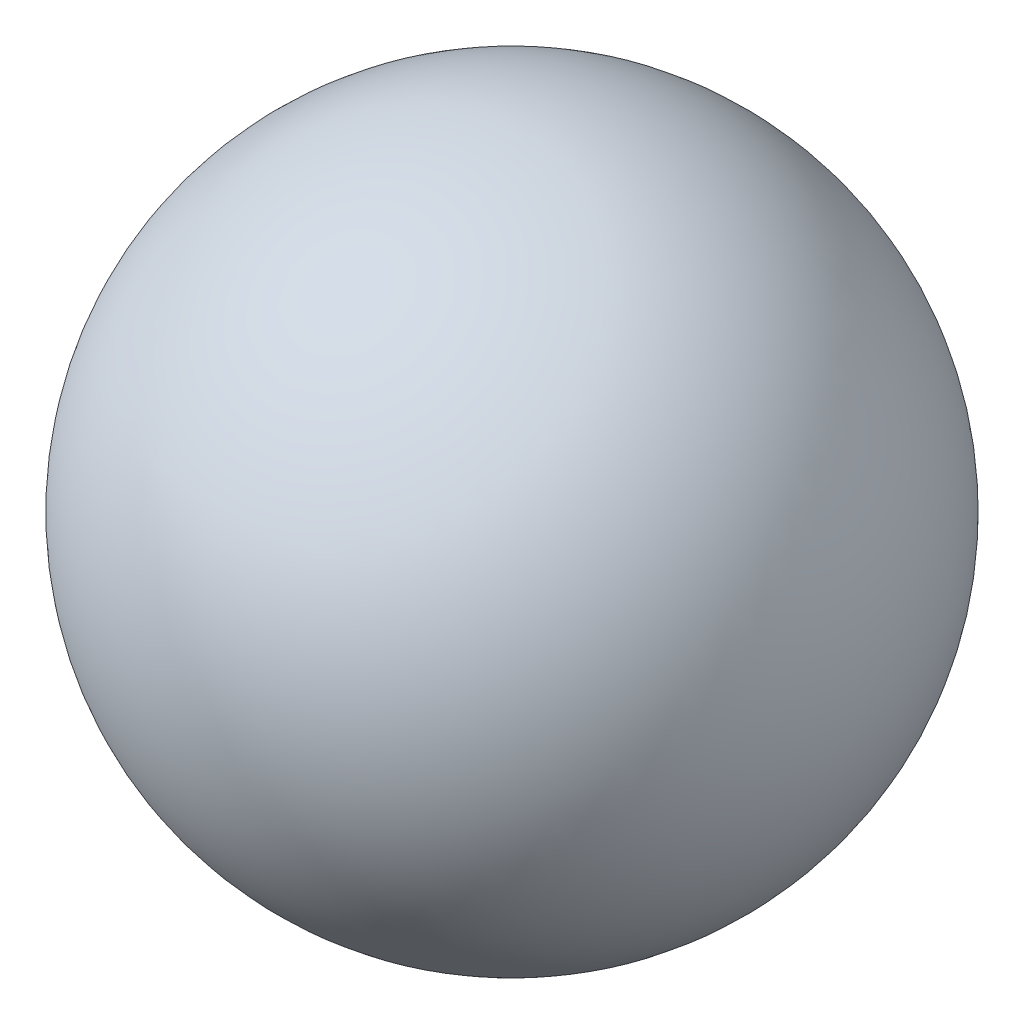
from build123d import *


with BuildPart() as part:
    # Sketch1 → Revolve1 (revolve)
    with BuildSketch(Plane.XY):
        with BuildLine():
            Line((0, 2.4), (0, -2.4))
            ThreePointArc((0, -2.4), (2.4, 0), (0, 2.4))
        make_face()
    revolve(axis=Axis((0, -2.4, 0), (0, 1, 0)))


solid = part.part
